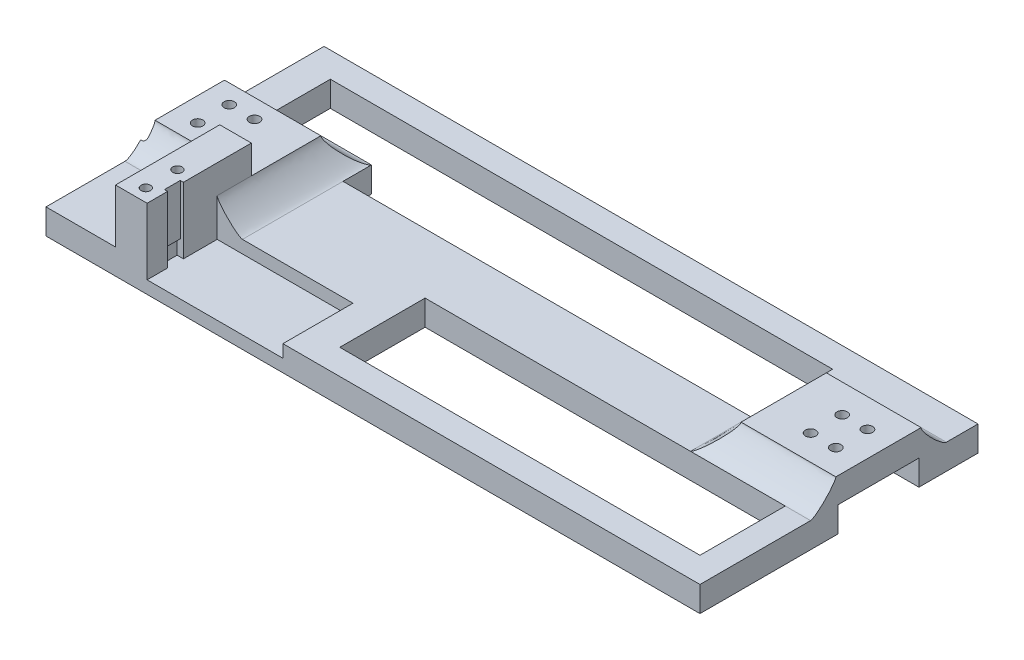
from build123d import *

# Parameters (mm, degrees)
SKETCH1_W            = 300
SKETCH1_H            = 20
BOSS_EXTRUDE1_DEPTH  = 8
SKETCH2_W            = 34
SKETCH2_H            = 8
BOSS_EXTRUDE2_DEPTH  = 9
SKETCH3_W            = 34
SKETCH3_H            = 8
BOSS_EXTRUDE3_DEPTH  = 9
SKETCH4_R            = 1.45
CUT_EXTRUDE1_DEPTH   = 302.504560496
SKETCH5_W            = 25
SKETCH5_H            = 8
BOSS_EXTRUDE4_DEPTH  = 17
SKETCH6_W            = 25
SKETCH6_H            = 8
BOSS_EXTRUDE5_DEPTH  = 17
SKETCH7_W            = 10
SKETCH7_H            = 38
CUT_EXTRUDE2_DEPTH   = 303.37890138
SKETCH8_W            = 7
SKETCH8_H            = 16
CUT_EXTRUDE3_DEPTH   = 4
CUT_EXTRUDE4_DEPTH   = 7
BOSS_EXTRUDE6_DEPTH  = 10
SKETCH12_W           = 8
SKETCH12_H           = 8
BOSS_EXTRUDE7_DEPTH  = 17
SKETCH13_R           = 1.7
CUT_EXTRUDE6_DEPTH   = 305.926220585
SKETCH14_W           = 20
SKETCH14_H           = 13
BOSS_EXTRUDE8_DEPTH  = 12
SKETCH15_R           = 1.6
CUT_EXTRUDE7_DEPTH   = 20
SKETCH16_W           = 20
SKETCH16_H           = 13
BOSS_EXTRUDE9_DEPTH  = 12
SKETCH17_R           = 1.6
CUT_EXTRUDE8_DEPTH   = 20
SKETCH18_W           = 20
SKETCH18_H           = 13
BOSS_EXTRUDE10_DEPTH = 12
CUT_EXTRUDE9_START   = -20
SKETCH19_R           = 1.6
CUT_EXTRUDE9_DEPTH   = 20
SKETCH20_W           = 20
SKETCH20_H           = 13
BOSS_EXTRUDE11_DEPTH = 12
CUT_EXTRUDE10_START  = -20
SKETCH21_R           = 1.6
CUT_EXTRUDE10_DEPTH  = 20
FILLET6_R            = 3
SKETCH22_W           = 114.514593174
SKETCH22_H           = 38.01155773
CUT_EXTRUDE11_DEPTH  = 59
SKETCH23_W           = 255.474860827
SKETCH23_H           = 73.711598505
CUT_EXTRUDE12_DEPTH  = 36
SKETCH24_W           = 30
SKETCH24_H           = 20
BOSS_EXTRUDE12_DEPTH = 8
SKETCH25_W           = 20
SKETCH25_H           = 8
CUT_EXTRUDE13_DEPTH  = 243.357174435
SKETCH26_R           = 1.65
CUT_EXTRUDE14_DEPTH  = 242.960740617
SKETCH27_W           = 30
SKETCH27_H           = 8
BOSS_EXTRUDE13_DEPTH = 15
SKETCH28_W           = 30
SKETCH28_H           = 26
BOSS_EXTRUDE14_DEPTH = 8
SKETCH29_W           = 21
SKETCH29_H           = 8
CUT_EXTRUDE17_DEPTH  = 25
SKETCH30_R           = 1.65
CUT_EXTRUDE18_DEPTH  = 242.960740617
SKETCH31_W           = 10
SKETCH31_H           = 8
BOSS_EXTRUDE15_DEPTH = 34
SKETCH32_W           = 10
SKETCH32_H           = 34
BOSS_EXTRUDE16_DEPTH = 17
SKETCH33_R           = 1.5
CUT_EXTRUDE19_DEPTH  = 249.237789226
SKETCH34_W           = 175
SKETCH34_H           = 34
SKETCH34_W_2         = 155
BOSS_EXTRUDE17_DEPTH = 8
SKETCH35_W           = 19
SKETCH35_H           = 8
BOSS_EXTRUDE23_DEPTH = 8
SKETCH36_W           = 30
SKETCH36_H           = 8
BOSS_EXTRUDE24_DEPTH = 1
SKETCH37_W           = 19
SKETCH37_H           = 8
BOSS_EXTRUDE25_DEPTH = 22
SKETCH38_W           = 30
SKETCH38_H           = 8
BOSS_EXTRUDE26_DEPTH = 1
SKETCH39_W           = 20
SKETCH39_H           = 8
BOSS_EXTRUDE27_DEPTH = 1
SKETCH49_W           = 10
SKETCH49_H           = 9
CUT_EXTRUDE25_DEPTH  = 1
SKETCH40_W           = 33.7
SKETCH40_H           = 8
BOSS_EXTRUDE28_DEPTH = 20
SKETCH41_W           = 114.01162948
SKETCH41_H           = 27
SKETCH41_W_2         = 34.98837052
SKETCH41_H_2         = 14.181402085
CUT_EXTRUDE20_DEPTH  = 248.560093715
SKETCH42_W           = 42.98837052
SKETCH42_H           = 22.181402085
BOSS_EXTRUDE29_DEPTH = 4
FILLET13_SIZE        = 8
SKETCH43_W           = 5
SKETCH43_H           = 21
CUT_EXTRUDE21_DEPTH  = 1
SKETCH44_W           = 5
SKETCH44_H           = 5
CUT_EXTRUDE22_DEPTH  = 1
SKETCH45_W           = 21
SKETCH45_H           = 0.3
CUT_EXTRUDE23_DEPTH  = 8
BOSS_EXTRUDE31_DEPTH = 2
FILLET14_START       = 34
FILLET14_DEPTH       = 31.9999999
FILLET14_START_2     = -9.0000001
FILLET14_2_DEPTH     = 8.0000001
FILLET14_START_3     = 65.99999999
FILLET14_3_DEPTH     = 8.00000011
SKETCH48_W           = 28
SKETCH48_H           = 23.779662164
CUT_EXTRUDE24_DEPTH  = 1.5
FILLET15_R           = 1


with BuildPart() as part:
    # Sketch1 → Boss-Extrude1 (new body)
    with BuildSketch(Plane(origin=(0, 0, 0), x_dir=(1, 0, 0), z_dir=(0, 1, 0))):
        with Locations((150, -10)):
            Rectangle(SKETCH1_W, SKETCH1_H)
    extrude(amount=BOSS_EXTRUDE1_DEPTH)

    # Sketch2 → Boss-Extrude2 (add)
    with BuildSketch(Plane.XY.offset(20)):
        with Locations((17, 4)):
            Rectangle(SKETCH2_W, SKETCH2_H)
        with Locations((283, 4)):
            Rectangle(SKETCH2_W, SKETCH2_H)
    extrude(amount=BOSS_EXTRUDE2_DEPTH)

    # Sketch3 → Boss-Extrude3 (add)
    with BuildSketch(Plane(origin=(0, 0, 0), x_dir=(-1, 0, 0), z_dir=(0, 0, -1))):
        with Locations((-17, 4)):
            Rectangle(SKETCH3_W, SKETCH3_H)
        with Locations((-283, 4)):
            Rectangle(SKETCH3_W, SKETCH3_H)
    extrude(amount=BOSS_EXTRUDE3_DEPTH)

    # Sketch4 → Cut-Extrude1 (cut, through all)
    with BuildSketch(Plane(origin=(0, 8, 0), x_dir=(1, 0, 0), z_dir=(0, 1, 0))):
        with Locations(Location((4, 5, 0), (0, 0, 270))):
            Circle(SKETCH4_R)
        with Locations(Location((30, 5, 0), (0, 0, 270))):
            Circle(SKETCH4_R)
        with Locations(Location((30, -25, 0), (0, 0, 270))):
            Circle(SKETCH4_R)
        with Locations(Location((4, -25, 0), (0, 0, 270))):
            Circle(SKETCH4_R)
        with Locations(Location((296, -25, 0), (0, 0, 270))):
            Circle(SKETCH4_R)
        with Locations(Location((296, 5, 0), (0, 0, 270))):
            Circle(SKETCH4_R)
        with Locations(Location((270, -25, 0), (0, 0, 270))):
            Circle(SKETCH4_R)
        with Locations(Location((270, 5, 0), (0, 0, 270))):
            Circle(SKETCH4_R)
    extrude(amount=-CUT_EXTRUDE1_DEPTH, mode=Mode.SUBTRACT)

    # Sketch5 → Boss-Extrude4 (add)
    with BuildSketch(Plane.XY.offset(20)):
        with Locations((253.5, 4)):
            Rectangle(SKETCH5_W, SKETCH5_H)
    extrude(amount=BOSS_EXTRUDE4_DEPTH)

    # Sketch6 → Boss-Extrude5 (add)
    with BuildSketch(Plane(origin=(0, 0, 0), x_dir=(-1, 0, 0), z_dir=(0, 0, -1))):
        with Locations((-253.5, 4)):
            Rectangle(SKETCH6_W, SKETCH6_H)
    extrude(amount=BOSS_EXTRUDE5_DEPTH)

    # Sketch7 → Cut-Extrude2 (cut, through all)
    with BuildSketch(Plane(origin=(0, 8, 0), x_dir=(1, 0, 0), z_dir=(0, 1, 0))):
        with Locations((254, -10)):
            Rectangle(SKETCH7_W, SKETCH7_H)
    extrude(amount=-CUT_EXTRUDE2_DEPTH, mode=Mode.SUBTRACT)

    # Sketch8 → Cut-Extrude3 (cut)
    with BuildSketch(Plane(origin=(0, 8, 0), x_dir=(1, 0, 0), z_dir=(0, 1, 0))):
        with Locations((262.5, -10)):
            Rectangle(SKETCH8_W, SKETCH8_H)
    extrude(amount=-CUT_EXTRUDE3_DEPTH, mode=Mode.SUBTRACT)

    # Sketch9 → Cut-Extrude4 (cut)
    with BuildSketch(Plane.ZY.offset(-259)):
        Polygon((18, 4), (22, 8), (18, 8), align=None)
        Polygon((2, 4), (-2, 8), (2, 8), align=None)
    extrude(amount=-CUT_EXTRUDE4_DEPTH, mode=Mode.SUBTRACT)

    # Sketch10 → Boss-Extrude6 (add)
    with BuildSketch(Plane.ZY.offset(-259)):
        Polygon((-2, 0), (-9, 8), (-9, 0), align=None)
        Polygon((29, 8), (22, 0), (29, 0), align=None)
    extrude(amount=BOSS_EXTRUDE6_DEPTH)

    # Sketch12 → Boss-Extrude7 (add)
    with BuildSketch(Plane.XY.offset(37)):
        with Locations((245, 4)):
            Rectangle(SKETCH12_W, SKETCH12_H)
    extrude(amount=BOSS_EXTRUDE7_DEPTH)

    # Sketch13 → Cut-Extrude6 (cut, through all)
    with BuildSketch(Plane(origin=(0, 8, 0), x_dir=(1, 0, 0), z_dir=(0, 1, 0))):
        with Locations(Location((245, -50, 0), (0, 0, 270))):
            Circle(SKETCH13_R)
        with Locations(Location((245, -18, 0), (0, 0, 270))):
            Circle(SKETCH13_R)
    extrude(amount=-CUT_EXTRUDE6_DEPTH, mode=Mode.SUBTRACT)

    # Sketch14 → Boss-Extrude8 (add)
    with BuildSketch(Plane.XY.offset(29)):
        with Locations((285, 6.5)):
            Rectangle(SKETCH14_W, SKETCH14_H)
    extrude(amount=BOSS_EXTRUDE8_DEPTH)

    # Sketch15 → Cut-Extrude7 (cut)
    with BuildSketch(Plane(origin=(295, 0, 0), x_dir=(0, 0, -1), z_dir=(1, 0, 0))):
        with Locations((-35, 8)):
            Circle(SKETCH15_R)
    extrude(amount=-CUT_EXTRUDE7_DEPTH, mode=Mode.SUBTRACT)

    # Sketch16 → Boss-Extrude9 (add)
    with BuildSketch(Plane(origin=(0, 0, -9), x_dir=(-1, 0, 0), z_dir=(0, 0, -1))):
        with Locations((-285, 6.5)):
            Rectangle(SKETCH16_W, SKETCH16_H)
    extrude(amount=BOSS_EXTRUDE9_DEPTH)

    # Sketch17 → Cut-Extrude8 (cut)
    with BuildSketch(Plane(origin=(295, 0, 0), x_dir=(0, 0, -1), z_dir=(1, 0, 0))):
        with Locations((15, 8)):
            Circle(SKETCH17_R)
    extrude(amount=-CUT_EXTRUDE8_DEPTH, mode=Mode.SUBTRACT)

    # Sketch18 → Boss-Extrude10 (add)
    with BuildSketch(Plane(origin=(0, 0, -9), x_dir=(-1, 0, 0), z_dir=(0, 0, -1))):
        with Locations((-15, 6.5)):
            Rectangle(SKETCH18_W, SKETCH18_H)
    extrude(amount=BOSS_EXTRUDE10_DEPTH)

    # Sketch19 → Cut-Extrude9 (cut)
    with BuildSketch(Plane.ZY.offset(-5).offset(CUT_EXTRUDE9_START)):
        with Locations(Location((-15, 8, 0), (0, 0, 180))):
            Circle(SKETCH19_R)
    extrude(amount=CUT_EXTRUDE9_DEPTH, mode=Mode.SUBTRACT)

    # Sketch20 → Boss-Extrude11 (add)
    with BuildSketch(Plane.XY.offset(29)):
        with Locations((15, 6.5)):
            Rectangle(SKETCH20_W, SKETCH20_H)
    extrude(amount=BOSS_EXTRUDE11_DEPTH)

    # Sketch21 → Cut-Extrude10 (cut)
    with BuildSketch(Plane.ZY.offset(-5).offset(CUT_EXTRUDE10_START)):
        with Locations(Location((35, 8, 0), (0, 0, 180))):
            Circle(SKETCH21_R)
    extrude(amount=CUT_EXTRUDE10_DEPTH, mode=Mode.SUBTRACT)

    # Fillet6
    fillet6_edges = [part.edges().sort_by_distance(p)[0] for p in [
        (285, 13, 29),
        (285, 13, 41),
        (285, 13, -9),
        (285, 13, -21),
        (15, 13, -9),
        (15, 13, -21),
        (15, 13, 29),
        (15, 13, 41),
    ]]
    fillet(fillet6_edges, radius=FILLET6_R)

    # Sketch22 → Cut-Extrude11 (cut)
    with BuildSketch(Plane(origin=(300, 0, 0), x_dir=(0, 0, -1), z_dir=(1, 0, 0))):
        with Locations((-15.649926743, 3.068885872)):
            Rectangle(SKETCH22_W, SKETCH22_H)
    extrude(amount=-CUT_EXTRUDE11_DEPTH, mode=Mode.SUBTRACT)

    # Sketch23 → Cut-Extrude12 (cut)
    with BuildSketch(Plane.ZY):
        with Locations((-8.880898517, 0.160078518)):
            Rectangle(SKETCH23_W, SKETCH23_H)
    extrude(amount=-CUT_EXTRUDE12_DEPTH, mode=Mode.SUBTRACT)

    # Sketch24 → Boss-Extrude12 (add)
    with BuildSketch(Plane(origin=(0, 8, 0), x_dir=(1, 0, 0), z_dir=(0, 1, 0))):
        with Locations((51, -10)):
            Rectangle(SKETCH24_W, SKETCH24_H)
    extrude(amount=BOSS_EXTRUDE12_DEPTH)

    # Sketch25 → Cut-Extrude13 (cut, through all)
    with BuildSketch(Plane(origin=(0, 0, 0), x_dir=(-1, 0, 0), z_dir=(0, 0, -1))):
        with Locations((-46, 4)):
            Rectangle(SKETCH25_W, SKETCH25_H)
    extrude(amount=-CUT_EXTRUDE13_DEPTH, mode=Mode.SUBTRACT)

    # Sketch26 → Cut-Extrude14 (cut, through all)
    with BuildSketch(Plane(origin=(0, 8, 0), x_dir=(-1, 0, 0), z_dir=(0, -1, 0))):
        with Locations(Location((-51, -5, 0), (0, 0, 180))):
            Circle(SKETCH26_R)
        with Locations(Location((-51, -15, 0), (0, 0, 180))):
            Circle(SKETCH26_R)
        with Locations(Location((-43, -5, 0), (0, 0, 180))):
            Circle(SKETCH26_R)
        with Locations(Location((-43, -15, 0), (0, 0, 180))):
            Circle(SKETCH26_R)
    extrude(amount=-CUT_EXTRUDE14_DEPTH, mode=Mode.SUBTRACT)

    # Sketch27 → Boss-Extrude13 (add)
    with BuildSketch(Plane(origin=(0, 0, 0), x_dir=(-1, 0, 0), z_dir=(0, 0, -1))):
        with Locations((-226, 4)):
            Rectangle(SKETCH27_W, SKETCH27_H)
    extrude(amount=BOSS_EXTRUDE13_DEPTH)

    # Sketch28 → Boss-Extrude14 (add)
    with BuildSketch(Plane(origin=(0, 8, 0), x_dir=(1, 0, 0), z_dir=(0, 1, 0))):
        with Locations((226, 2)):
            Rectangle(SKETCH28_W, SKETCH28_H)
    extrude(amount=BOSS_EXTRUDE14_DEPTH)

    # Sketch29 → Cut-Extrude17 (cut)
    with BuildSketch(Plane(origin=(0, 0, -15), x_dir=(-1, 0, 0), z_dir=(0, 0, -1))):
        with Locations((-230.5, 4)):
            Rectangle(SKETCH29_W, SKETCH29_H)
    extrude(amount=-CUT_EXTRUDE17_DEPTH, mode=Mode.SUBTRACT)

    # Sketch30 → Cut-Extrude18 (cut, through all)
    with BuildSketch(Plane(origin=(0, 8, 0), x_dir=(-1, 0, 0), z_dir=(0, -1, 0))):
        with Locations(Location((-225, 7, 0), (0, 0, 90))):
            Circle(SKETCH30_R)
        with Locations(Location((-225, -3, 0), (0, 0, 90))):
            Circle(SKETCH30_R)
        with Locations(Location((-233, 7, 0), (0, 0, 90))):
            Circle(SKETCH30_R)
        with Locations(Location((-233, -3, 0), (0, 0, 90))):
            Circle(SKETCH30_R)
    extrude(amount=-CUT_EXTRUDE18_DEPTH, mode=Mode.SUBTRACT)

    # Sketch31 → Boss-Extrude15 (add)
    with BuildSketch(Plane.XY.offset(20)):
        with Locations((61, 4)):
            Rectangle(SKETCH31_W, SKETCH31_H)
    extrude(amount=BOSS_EXTRUDE15_DEPTH)

    # Sketch32 → Boss-Extrude16 (add)
    with BuildSketch(Plane(origin=(0, 8, 0), x_dir=(1, 0, 0), z_dir=(0, 1, 0))):
        with Locations((61, -37)):
            Rectangle(SKETCH32_W, SKETCH32_H)
    extrude(amount=BOSS_EXTRUDE16_DEPTH)

    # Sketch33 → Cut-Extrude19 (cut, through all)
    with BuildSketch(Plane(origin=(0, 25, 0), x_dir=(1, 0, 0), z_dir=(0, 1, 0))):
        with Locations(Location((61.6, -40, 0), (0, 0, 270))):
            Circle(SKETCH33_R)
        with Locations(Location((61.6, -50, 0), (0, 0, 270))):
            Circle(SKETCH33_R)
    extrude(amount=-CUT_EXTRUDE19_DEPTH, mode=Mode.SUBTRACT)

    # Sketch34 → Boss-Extrude17 (add)
    with BuildSketch(Plane(origin=(0, 0, 0), x_dir=(-1, 0, 0), z_dir=(0, -1, 0))):
        with Locations((-153.5, -37)):
            Rectangle(SKETCH34_W, SKETCH34_H)
        with Locations((-133.5, 17)):
            Rectangle(SKETCH34_W_2, SKETCH34_H)
    extrude(amount=-BOSS_EXTRUDE17_DEPTH)

    # Sketch35 → Boss-Extrude23 (add)
    with BuildSketch(Plane(origin=(211, 0, 0), x_dir=(0, 0, -1), z_dir=(1, 0, 0))):
        with Locations((24.5, 4)):
            Rectangle(SKETCH35_W, SKETCH35_H)
    extrude(amount=BOSS_EXTRUDE23_DEPTH)

    # Sketch36 → Boss-Extrude24 (add)
    with BuildSketch(Plane(origin=(0, 0, -15), x_dir=(-1, 0, 0), z_dir=(0, 0, -1))):
        with Locations((-226, 12)):
            Rectangle(SKETCH36_W, SKETCH36_H)
    extrude(amount=BOSS_EXTRUDE24_DEPTH)

    # Sketch37 → Boss-Extrude25 (add)
    with BuildSketch(Plane(origin=(219, 0, 0), x_dir=(0, 0, -1), z_dir=(1, 0, 0))):
        with Locations((24.5, 4)):
            Rectangle(SKETCH37_W, SKETCH37_H)
    extrude(amount=BOSS_EXTRUDE25_DEPTH)

    # Sketch38 → Boss-Extrude26 (add)
    with BuildSketch(Plane(origin=(0, 0, 0), x_dir=(-1, 0, 0), z_dir=(0, 0, -1))):
        with Locations((-51, 12)):
            Rectangle(SKETCH38_W, SKETCH38_H)
    extrude(amount=BOSS_EXTRUDE26_DEPTH)

    # Sketch39 → Boss-Extrude27 (add)
    with BuildSketch(Plane.XY.offset(20)):
        with Locations((46, 12)):
            Rectangle(SKETCH39_W, SKETCH39_H)
    extrude(amount=BOSS_EXTRUDE27_DEPTH)

    # Sketch49 → Cut-Extrude25 (cut)
    with BuildSketch(Plane(origin=(0, 0, 20), x_dir=(-1, 0, 0), z_dir=(0, 0, -1))):
        with Locations((-61, 20.5)):
            Rectangle(SKETCH49_W, SKETCH49_H)
    extrude(amount=-CUT_EXTRUDE25_DEPTH, mode=Mode.SUBTRACT)

    # Sketch40 → Boss-Extrude28 (add)
    with BuildSketch(Plane.ZY.offset(-56)):
        with Locations((-17.15, 4)):
            Rectangle(SKETCH40_W, SKETCH40_H)
        with Locations((37.15, 4)):
            Rectangle(SKETCH40_W, SKETCH40_H)
    extrude(amount=BOSS_EXTRUDE28_DEPTH)

    # Sketch41 → Cut-Extrude20 (cut, through all)
    with BuildSketch(Plane(origin=(0, 8, 0), x_dir=(1, 0, 0), z_dir=(0, 1, 0))):
        with Locations((175.99418526, -32.5)):
            Rectangle(SKETCH41_W, SKETCH41_H)
        Polygon((44, 9), (74, 9), (74, 0), (203, 0), (203, 26), (44, 26), align=None)
        with Locations((91.49418526, -38.909298957)):
            Rectangle(SKETCH41_W_2, SKETCH41_H_2)
        Polygon((108.98837052, -54), (108.98837052, -46), (74, -46), (74, -31.818597915), (66, -31.818597915), (66, -54), align=None)
    extrude(amount=-CUT_EXTRUDE20_DEPTH, mode=Mode.SUBTRACT)

    # Sketch42 → Boss-Extrude29 (add)
    with BuildSketch(Plane(origin=(0, 0, 0), x_dir=(-1, 0, 0), z_dir=(0, -1, 0))):
        with Locations((-87.49418526, -42.909298957)):
            Rectangle(SKETCH42_W, SKETCH42_H)
    extrude(amount=-BOSS_EXTRUDE29_DEPTH)

    # Fillet13
    # a fillet whose section is not a circle: 8 mm, written as the material it adds along each edge
    with BuildSketch(Plane(origin=(66, 8, -1), x_dir=(1, 0, 0), z_dir=(0, 0, 1))) as fillet13_piece_1:
        with BuildLine():
            Bezier((FILLET13_SIZE, 0), (0, 0), (0, FILLET13_SIZE), weights=[1, 0.176470588, 1])
            Line((0, FILLET13_SIZE), (0, 0))
            Line((0, 0), (FILLET13_SIZE, 0))
        make_face()
    extrude(amount=32.818597915)
    with BuildSketch(Plane(origin=(211, 8, -16), x_dir=(0, 0, -1), z_dir=(1, 0, 0))) as fillet13_piece_2:
        with BuildLine():
            Bezier((FILLET13_SIZE, 0), (0, 0), (0, FILLET13_SIZE), weights=[1, 0.176470588, 1])
            Line((0, FILLET13_SIZE), (0, 0))
            Line((0, 0), (FILLET13_SIZE, 0))
        make_face()
    extrude(amount=30)
    with BuildSketch(Plane(origin=(211, 8, 11), x_dir=(0, 0, 1), z_dir=(1, 0, 0))) as fillet13_piece_3:
        with BuildLine():
            Bezier((FILLET13_SIZE, 0), (0, 0), (0, -FILLET13_SIZE), weights=[1, 0.176470588, 1])
            Line((0, -FILLET13_SIZE), (0, 0))
            Line((0, 0), (FILLET13_SIZE, 0))
        make_face()
    extrude(amount=30)
    with BuildSketch(Plane(origin=(211, 8, 11), x_dir=(-1, 0, 0), z_dir=(0, 0, -1))) as fillet13_piece_4:
        with BuildLine():
            Bezier((FILLET13_SIZE, 0), (0, 0), (0, FILLET13_SIZE), weights=[1, 0.176470588, 1])
            Line((0, FILLET13_SIZE), (0, 0))
            Line((0, 0), (FILLET13_SIZE, 0))
        make_face()
    extrude(amount=27)
    with BuildSketch(Plane(origin=(211, 8, 11), x_dir=(-1, 0, 0), z_dir=(0, 0, -1))) as fillet13_piece_5a_section:
        with BuildLine():
            Bezier((FILLET13_SIZE, 0), (0, 0), (0, FILLET13_SIZE), weights=[1, 0.176470588, 1])
            Line((0, FILLET13_SIZE), (0, 0))
            Line((0, 0), (FILLET13_SIZE, 0))
        make_face()
    fillet13_piece_5a = extrude(amount=47, mode=Mode.PRIVATE)
    fillet13_piece_5a = split(fillet13_piece_5a, bisect_by=Plane(origin=(211, 8, -26), z_dir=(0, 0, 1)), keep=Keep.TOP, mode=Mode.PRIVATE)
    fillet13_piece_5a = split(fillet13_piece_5a, bisect_by=Plane(origin=(211, 8, -16), z_dir=(0, 0, -1)), keep=Keep.TOP, mode=Mode.PRIVATE)
    with BuildSketch(Plane(origin=(191, 8, -16), x_dir=(0, 0, -1), z_dir=(1, 0, 0))) as fillet13_piece_5b_section:
        with BuildLine():
            Bezier((FILLET13_SIZE, 0), (0, 0), (0, FILLET13_SIZE), weights=[1, 0.176470588, 1])
            Line((0, FILLET13_SIZE), (0, 0))
            Line((0, 0), (FILLET13_SIZE, 0))
        make_face()
    fillet13_piece_5b = extrude(amount=50, mode=Mode.PRIVATE)
    fillet13_piece_5b = split(fillet13_piece_5b, bisect_by=Plane(origin=(203, 8, -16), z_dir=(1, 0, 0)), keep=Keep.TOP, mode=Mode.PRIVATE)
    fillet13_piece_5b = split(fillet13_piece_5b, bisect_by=Plane(origin=(211, 8, -16), z_dir=(-1, 0, 0)), keep=Keep.TOP, mode=Mode.PRIVATE)
    fillet13_piece_5 = fillet13_piece_5a & fillet13_piece_5b
    add(fillet13_piece_5)
    with BuildSketch(Plane(origin=(191, 8, 11), x_dir=(0, 0, 1), z_dir=(1, 0, 0))) as fillet13_piece_6a_section:
        with BuildLine():
            Bezier((FILLET13_SIZE, 0), (0, 0), (0, -FILLET13_SIZE), weights=[1, 0.176470588, 1])
            Line((0, -FILLET13_SIZE), (0, 0))
            Line((0, 0), (FILLET13_SIZE, 0))
        make_face()
    fillet13_piece_6a = extrude(amount=50, mode=Mode.PRIVATE)
    fillet13_piece_6a = split(fillet13_piece_6a, bisect_by=Plane(origin=(211, 8, 11), z_dir=(-1, 0, 0)), keep=Keep.TOP, mode=Mode.PRIVATE)
    with BuildSketch(Plane(origin=(211, 8, 31), x_dir=(-1, 0, 0), z_dir=(0, 0, -1))) as fillet13_piece_6b_section:
        with BuildLine():
            Bezier((FILLET13_SIZE, 0), (0, 0), (0, FILLET13_SIZE), weights=[1, 0.176470588, 1])
            Line((0, FILLET13_SIZE), (0, 0))
            Line((0, 0), (FILLET13_SIZE, 0))
        make_face()
    fillet13_piece_6b = extrude(amount=47, mode=Mode.PRIVATE)
    fillet13_piece_6b = split(fillet13_piece_6b, bisect_by=Plane(origin=(211, 8, 19), z_dir=(0, 0, -1)), keep=Keep.TOP, mode=Mode.PRIVATE)
    fillet13_piece_6b = split(fillet13_piece_6b, bisect_by=Plane(origin=(211, 8, 11), z_dir=(0, 0, 1)), keep=Keep.TOP, mode=Mode.PRIVATE)
    fillet13_piece_6 = fillet13_piece_6a & fillet13_piece_6b
    add(fillet13_piece_6)

    # Sketch43 → Cut-Extrude21 (cut)
    with BuildSketch(Plane(origin=(66, 0, 0), x_dir=(0, 0, -1), z_dir=(1, 0, 0))):
        with Locations((-45, 14.5)):
            Rectangle(SKETCH43_W, SKETCH43_H)
    extrude(amount=-CUT_EXTRUDE21_DEPTH, mode=Mode.SUBTRACT)

    # Sketch44 → Cut-Extrude22 (cut)
    with BuildSketch(Plane(origin=(65, 0, 0), x_dir=(0, 0, -1), z_dir=(1, 0, 0))):
        with Locations((-45, 6.5)):
            Rectangle(SKETCH44_W, SKETCH44_H)
    extrude(amount=-CUT_EXTRUDE22_DEPTH, mode=Mode.SUBTRACT)

    # Sketch45 → Cut-Extrude23 (cut)
    with BuildSketch(Plane(origin=(0, 0, 0), x_dir=(-1, 0, 0), z_dir=(0, -1, 0))):
        with Locations((-230.5, 15.15)):
            Rectangle(SKETCH45_W, SKETCH45_H)
        with Locations((-230.5, -10.15)):
            Rectangle(SKETCH45_W, SKETCH45_H)
    extrude(amount=-CUT_EXTRUDE23_DEPTH, mode=Mode.SUBTRACT)

    # Sketch47 → Boss-Extrude31 (add)
    with BuildSketch(Plane.ZY.offset(-36)):
        Polygon((20.3, 8), (20.3, 0), (54, 0), (54, 8), (21, 8), (21, 16), (-1, 16), (-1, 8), (-34, 8), (-34, 0), (-0.3, 0), (-0.3, 8), align=None)
    extrude(amount=BOSS_EXTRUDE31_DEPTH)

    # Fillet14: read off the stored shape, not the designer's step
    # Fillet14 outline → Fillet14 (add)
    with BuildSketch(Plane.YZ.offset(FILLET14_START)):
        with BuildLine():
            add(Edge.make_bspline(
                [(8, 29), (8, 21), (16, 21)],
                knots=[0, 0, 0, 1, 1, 1], degree=2, weights=[1, 0.25, 1]))
            Line((8, 29), (8, 21))
            Line((8, 21), (16, 21))
        make_face()
        with BuildLine():
            Line((8, -1), (8, -9))
            add(Edge.make_bspline(
                [(8, -9), (8, -1), (16, -1)],
                knots=[0, 0, 0, 1, 1, 1], degree=2, weights=[1, 0.25, 1]))
            Line((16, -1), (8, -1))
        make_face()
    extrude(amount=FILLET14_DEPTH)

    # Fillet14 2 outline → Fillet14 2 (add)
    with BuildSketch(Plane.XY.offset(FILLET14_START_2)):
        with BuildLine():
            add(Edge.make_bspline(
                [(66, 16), (66, 8), (74, 8)],
                knots=[0, 0, 0, 1, 1, 1], degree=2, weights=[1, 0.176470588, 1]))
            Line((66, 16), (65.9999999, 8))
            Line((65.9999999, 8), (74, 8))
        make_face()
    extrude(amount=FILLET14_2_DEPTH)

    # Fillet14 3 outline → Fillet14 3 (cut)
    with BuildSketch(Plane.YZ.offset(FILLET14_START_3)):
        with BuildLine():
            add(Edge.make_bspline(
                [(8, -9), (8, -1), (16, -1)],
                knots=[0, 0, 0, 1, 1, 1], degree=2, weights=[1, 0.25, 1]))
            Line((8, -9), (16, -9.0000001))
            Line((16, -9.0000001), (16, -1))
        make_face()
    extrude(amount=FILLET14_3_DEPTH, mode=Mode.SUBTRACT)

    # Sketch48 → Cut-Extrude24 (cut)
    with BuildSketch(Plane.ZY.offset(-34)):
        with Locations((10, 6.933054746)):
            Rectangle(SKETCH48_W, SKETCH48_H)
    extrude(amount=-CUT_EXTRUDE24_DEPTH, mode=Mode.SUBTRACT)

    # Fillet15
    fillet15_edges = [part.edges().sort_by_distance(p)[0] for p in [
        (35.5, 5.701266635, 24),
        (35.5, 5.701266635, -4),
    ]]
    fillet(fillet15_edges, radius=FILLET15_R)


solid = part.part
